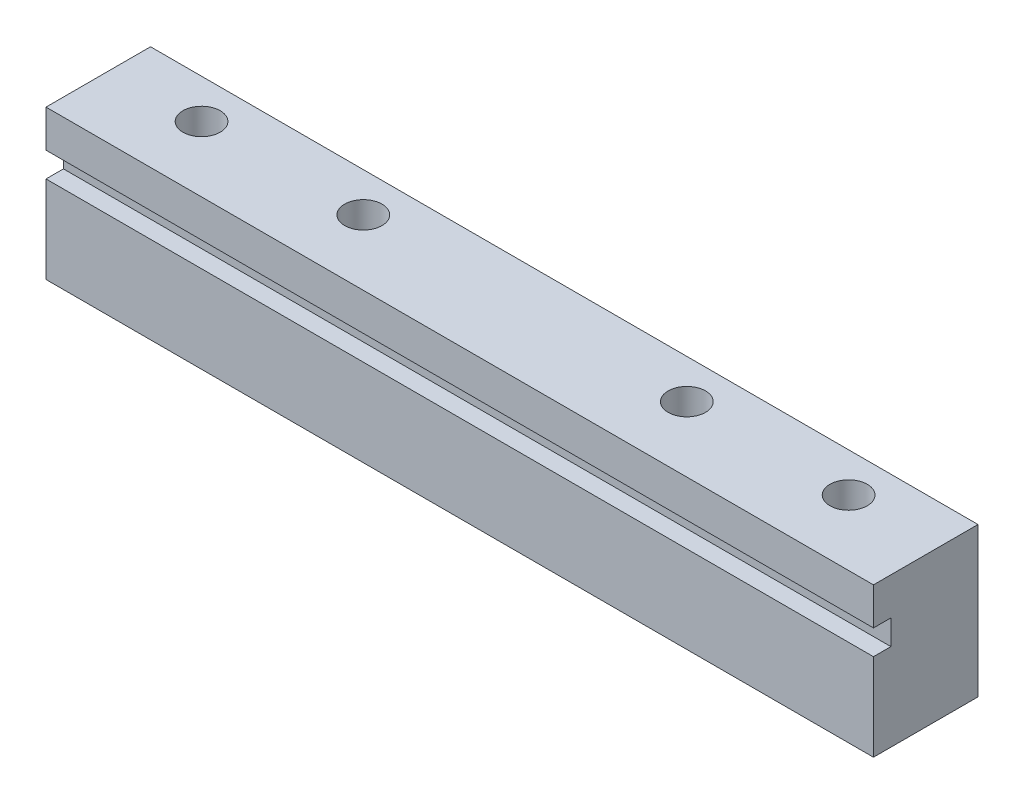
from build123d import *

# Parameters (mm, degrees)
SKETCH_1_W          = 66.5
SKETCH_1_H          = 8.4
EXTRUDE_1_DEPTH     = 12
SKETCH_2_W          = 1.4
SKETCH_2_H          = 2
CUT_EXTRUDE_1_DEPTH = 104
SKETCH_4_R          = 1.5
CUT_EXTRUDE_3_DEPTH = 36.597787853


with BuildPart() as part:
    # 草图1 → 凸台-拉伸1 (new body)
    with BuildSketch(Plane(origin=(0, 0, 0), x_dir=(1, 0, 0), z_dir=(0, 1, 0))):
        Rectangle(SKETCH_1_W, SKETCH_1_H)
    extrude(amount=EXTRUDE_1_DEPTH)

    # 草图2 → 切除-拉伸1 (cut)
    with BuildSketch(Plane(origin=(33.25, 0, 0), x_dir=(0, 0, -1), z_dir=(1, 0, 0))):
        with Locations((-3.5, 8)):
            Rectangle(SKETCH_2_W, SKETCH_2_H)
    extrude(amount=-CUT_EXTRUDE_1_DEPTH, mode=Mode.SUBTRACT)

    # 草图4 → 切除-拉伸3 (cut, through all)
    with BuildSketch(Plane.XZ):
        with Locations((-26, -1.05)):
            Circle(SKETCH_4_R)
        with Locations((-13, -1.05)):
            Circle(SKETCH_4_R)
        with Locations((26, -1.05)):
            Circle(SKETCH_4_R)
        with Locations((13, -1.05)):
            Circle(SKETCH_4_R)
    extrude(amount=-CUT_EXTRUDE_3_DEPTH, mode=Mode.SUBTRACT)


solid = part.part
